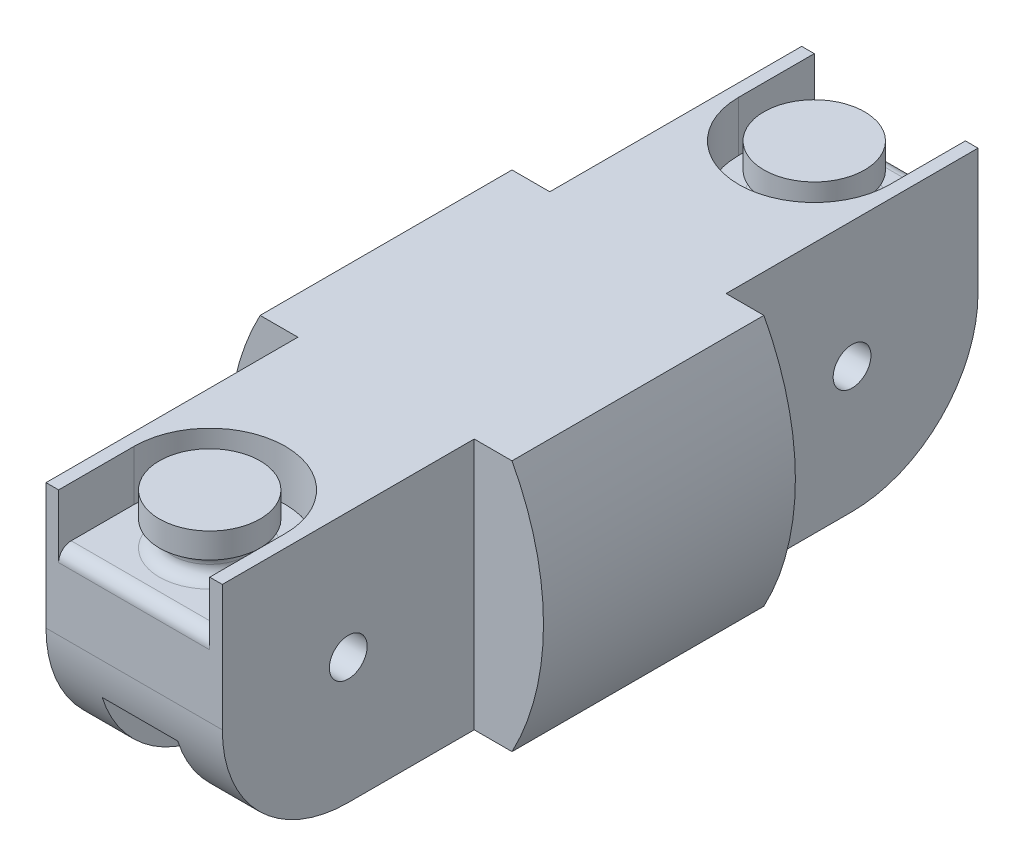
from build123d import *

# Parameters (mm, degrees)
SALIENTE_EXTRUIR1_DEPTH = 20
CROQUIS5_R              = 1.5
CORTAR_EXTRUIR3_DEPTH   = 20
SALIENTE_EXTRUIR2_DEPTH = 20
SALIENTE_EXTRUIR3_DEPTH = 20
CROQUIS4_R              = 1.5
CORTAR_EXTRUIR2_DEPTH   = 14
REDONDEO1_R             = 10
CUT_EXTRUDE1_DEPTH      = 4
SKETCH2_R               = 3
BOSS_EXTRUDE1_DEPTH     = 2
SKETCH3_R               = 4
BOSS_EXTRUDE2_DEPTH     = 2
FILLET1_R               = 1
FILLET2_R               = 1
FILLET3_R               = 1


with BuildPart() as part:
    # Croquis1 → Saliente-Extruir1 (new body)
    with BuildSketch(Plane.XY):
        with BuildLine():
            Line((-10, 10), (10, 10))
            ThreePointArc((10, 10), (12.5, 0), (10, -10))
            Line((10, -10), (-10, -10))
            ThreePointArc((-10, -10), (-12.5, 0), (-10, 10))
        make_face()
    extrude(amount=SALIENTE_EXTRUIR1_DEPTH)

    # Croquis5 → Cortar-Extruir3 (cut)
    with BuildSketch(Plane(origin=(0, 0, 0), x_dir=(-1, 0, 0), z_dir=(0, 0, -1))):
        with Locations((0, -7)):
            Circle(CROQUIS5_R)
    extrude(amount=-CORTAR_EXTRUIR3_DEPTH, mode=Mode.SUBTRACT)

    # Croquis2 → Saliente-Extruir2 (add)
    with BuildSketch(Plane(origin=(0, 0, 0), x_dir=(-1, 0, 0), z_dir=(0, 0, -1))):
        Polygon((-7, 10), (-7, -10), (-3, -10), (-3, -3), (3, -3), (3, -10), (7, -10), (7, 10), align=None)
    extrude(amount=SALIENTE_EXTRUIR2_DEPTH)

    # Croquis3 → Saliente-Extruir3 (add)
    with BuildSketch(Plane.XY.offset(20)):
        Polygon((-7, 10), (-7, -10), (-3, -10), (-3, -3), (3, -3), (3, -10), (7, -10), (7, 10), align=None)
    extrude(amount=SALIENTE_EXTRUIR3_DEPTH)

    # Croquis4 → Cortar-Extruir2 (cut)
    with BuildSketch(Plane.ZY.offset(7)):
        with Locations((-10, 0)):
            Circle(CROQUIS4_R)
        with Locations((30, 0)):
            Circle(CROQUIS4_R)
    extrude(amount=-CORTAR_EXTRUIR2_DEPTH, mode=Mode.SUBTRACT)

    # Redondeo1
    redondeo1_edges = [part.edges().sort_by_distance(p)[0] for p in [
        (-5, -10, 40),
        (-5, -10, -20),
    ]]
    fillet(redondeo1_edges, radius=REDONDEO1_R)

    # Sketch1 → Cut-Extrude1 (cut)
    with BuildSketch(Plane(origin=(0, 10, 0), x_dir=(1, 0, 0), z_dir=(0, 1, 0))):
        with BuildLine():
            Line((-6, 14), (-6, 20))
            Line((-6, 20), (6, 20))
            Line((6, 20), (6, 14))
            ThreePointArc((6, 14), (0, 8), (-6, 14))
        make_face()
        with BuildLine():
            Line((-6, -34), (-6, -40))
            Line((-6, -40), (6, -40))
            Line((6, -40), (6, -34))
            ThreePointArc((6, -34), (0, -28), (-6, -34))
        make_face()
    extrude(amount=-CUT_EXTRUDE1_DEPTH, mode=Mode.SUBTRACT)

    # Sketch2 → Boss-Extrude1 (add)
    with BuildSketch(Plane(origin=(0, 6, 0), x_dir=(1, 0, 0), z_dir=(0, 1, 0))):
        with Locations(Location((0, -34, 0), (0, 0, 270))):
            Circle(SKETCH2_R)
        with Locations(Location((0, 14, 0), (0, 0, 270))):
            Circle(SKETCH2_R)
    extrude(amount=BOSS_EXTRUDE1_DEPTH)

    # Sketch3 → Boss-Extrude2 (add)
    with BuildSketch(Plane(origin=(0, 8, 0), x_dir=(1, 0, 0), z_dir=(0, 1, 0))):
        with Locations(Location((0, -34, 0), (0, 0, 270))):
            Circle(SKETCH3_R)
        with Locations(Location((0, 14, 0), (0, 0, 270))):
            Circle(SKETCH3_R)
    extrude(amount=BOSS_EXTRUDE2_DEPTH)

    # Fillet1
    fillet1_edges = [part.edges().sort_by_distance(p)[0] for p in [
        (0, 6, 31),
        (0, 8, 31),
        (0, 6, -17),
        (0, 8, -17),
    ]]
    fillet(fillet1_edges, radius=FILLET1_R - 0.0001)  # a hair under: the kernel refuses the full size

    # Fillet2
    fillet2_edges = [part.edges().sort_by_distance(p)[0] for p in [
        (0, 6, 40),
        (0, 6, -20),
    ]]
    fillet(fillet2_edges, radius=FILLET2_R)

    # Fillet3
    fillet3_edges = [part.edges().sort_by_distance(p)[0] for p in [
        (1.5, -7, 20),
        (1.5, -7, 0),
    ]]
    fillet(fillet3_edges, radius=FILLET3_R)


solid = part.part
